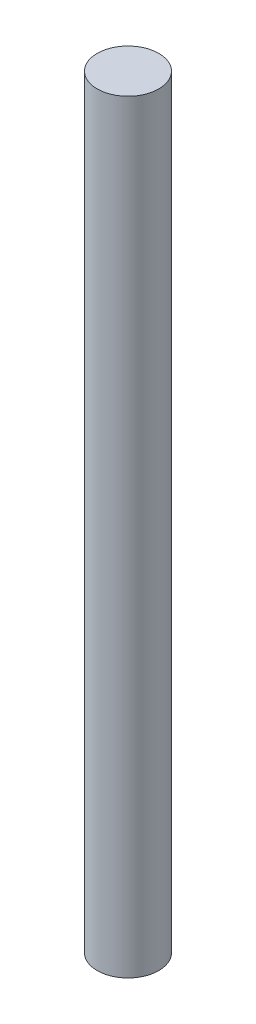
from build123d import *

# Parameters (mm, degrees)
SKETCH1_R           = 1.5875
BOSS_EXTRUDE1_DEPTH = 39.37


with BuildPart() as part:
    # Sketch1 → Boss-Extrude1 (new body)
    with BuildSketch(Plane(origin=(0, 0, 0), x_dir=(1, 0, 0), z_dir=(0, 1, 0))):
        Circle(SKETCH1_R)
    extrude(amount=BOSS_EXTRUDE1_DEPTH)


solid = part.part
